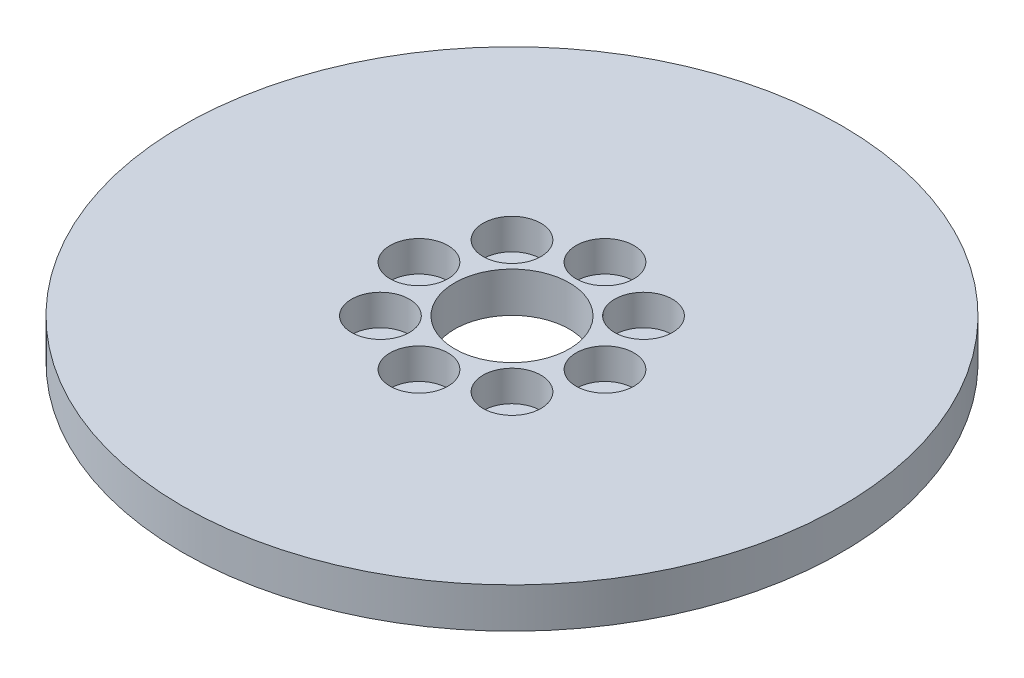
from build123d import *

# Parameters (mm, degrees)
SKETCH1_R           = 57.5
BOSS_EXTRUDE1_DEPTH = 7
SKETCH2_R           = 10
CUT_EXTRUDE1_DEPTH  = 82.618012718
SKETCH3_R           = 5.046948053
CUT_EXTRUDE2_DEPTH  = 5.37114165
CIRPATTERN1_COUNT   = 8


with BuildPart() as part:
    # Sketch1 → Boss-Extrude1 (new body)
    with BuildSketch(Plane(origin=(0, 0, 0), x_dir=(1, 0, 0), z_dir=(0, 1, 0))):
        Circle(SKETCH1_R)
    extrude(amount=BOSS_EXTRUDE1_DEPTH)

    # Sketch2 → Cut-Extrude1 (cut, through all)
    with BuildSketch(Plane(origin=(0, 0, 0), x_dir=(1, 0, 0), z_dir=(0, 1, 0))):
        Circle(SKETCH2_R)
    extrude(amount=CUT_EXTRUDE1_DEPTH, mode=Mode.SUBTRACT)

    # Sketch3 → Cut-Extrude2 (cut)
    with BuildSketch(Plane(origin=(0, 7, 0), x_dir=(1, 0, 0), z_dir=(0, 1, 0))):
        with Locations((-16.228606561, 0)):
            Circle(SKETCH3_R)
    cut_extrude2 = extrude(amount=-CUT_EXTRUDE2_DEPTH, mode=Mode.SUBTRACT)

    # CirPattern1: Cut-Extrude2 ×8 about axis
    cirpattern1_axis = Axis((0, 0, 0), (0, 1, 0))
    for i in range(1, CIRPATTERN1_COUNT):
        add(cut_extrude2.rotate(cirpattern1_axis, i * 360 / CIRPATTERN1_COUNT), mode=Mode.SUBTRACT)


solid = part.part
